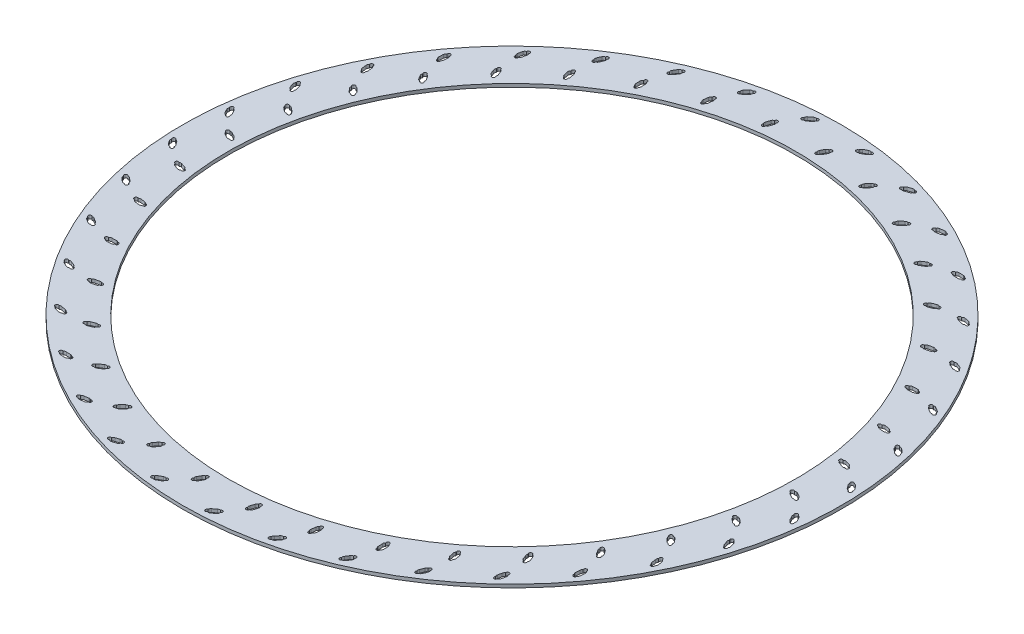
from build123d import *

# Parameters (mm, degrees)
SKETCH1_R          = 201.5
SKETCH1_R_2        = 173.5
BASE_FLANGE1_DEPTH = 2
CUT_EXTRUDE1_DEPTH = 10
CIRPATTERN1_COUNT  = 36


# Sheet-metal steps are written as plain solids
with BuildPart() as part:
    # Sketch1 → Base-Flange1 (new body)
    with BuildSketch(Plane(origin=(0, 0, 0), x_dir=(1, 0, 0), z_dir=(0, 1, 0))):
        with Locations(Location((0, 0, 0), (0, 0, 270))):
            Circle(SKETCH1_R)
        with Locations(Location((0, 0, 0), (0, 0, 270))):
            Circle(SKETCH1_R_2, mode=Mode.SUBTRACT)
    extrude(amount=-BASE_FLANGE1_DEPTH)

    # Sketch6 → Cut-Extrude1 (cut)
    with BuildSketch(Plane.XZ.offset(2)):
        with BuildLine():
            ThreePointArc((177.612549987, -22.588547774), (176.53344221, -23.822359392), (178.062779342, -24.412183639))
            ThreePointArc((178.062779342, -24.412183639), (178.784151638, -24.783045054), (179.595079064, -24.765356427))
            ThreePointArc((179.595079064, -24.765356427), (180.955345353, -24.355853974), (182.296031452, -23.886197274))
            ThreePointArc((182.296031452, -23.886197274), (182.961997259, -23.423157618), (183.326853087, -22.69872929))
            ThreePointArc((183.326853087, -22.69872929), (184.215978762, -21.321696161), (182.617365105, -20.959482027))
            ThreePointArc((182.617365105, -20.959482027), (181.896061338, -20.701370261), (181.13593766, -20.796831256))
            ThreePointArc((181.13593766, -20.796831256), (179.933943226, -21.21790278), (178.71439414, -21.58504291))
            ThreePointArc((178.71439414, -21.58504291), (178.043718651, -21.955306594), (177.612549987, -22.588547774))
        make_face()
        with BuildLine():
            ThreePointArc((192.446623859, -14.077843294), (192.240039835, -15.703908406), (193.838170501, -15.339569169))
            ThreePointArc((193.838170501, -15.339569169), (194.643709947, -15.244582965), (195.306654924, -14.777228565))
            ThreePointArc((195.306654924, -14.777228565), (196.20666193, -13.678136202), (197.056843948, -12.540064513))
            ThreePointArc((197.056843948, -12.540064513), (197.350910408, -11.784127283), (197.249235476, -10.97940473))
            ThreePointArc((197.249235476, -10.97940473), (197.218243527, -9.340562393), (195.689691943, -9.932419436))
            ThreePointArc((195.689691943, -9.932419436), (194.947148797, -10.120914752), (194.369769553, -10.624436366))
            ThreePointArc((194.369769553, -10.624436366), (193.607537399, -11.644776502), (192.800634566, -12.630169654))
            ThreePointArc((192.800634566, -12.630169654), (192.450870848, -13.31176055), (192.446623859, -14.077843294))
        make_face()
    cut_extrude1 = extrude(amount=-CUT_EXTRUDE1_DEPTH, mode=Mode.SUBTRACT)

    # CirPattern1: Cut-Extrude1 ×36 about axis
    cirpattern1_axis = Axis((0, 0, 0), (0, 1, 0))
    for i in range(1, CIRPATTERN1_COUNT):
        add(cut_extrude1.rotate(cirpattern1_axis, i * 360 / CIRPATTERN1_COUNT), mode=Mode.SUBTRACT)


solid = part.part
